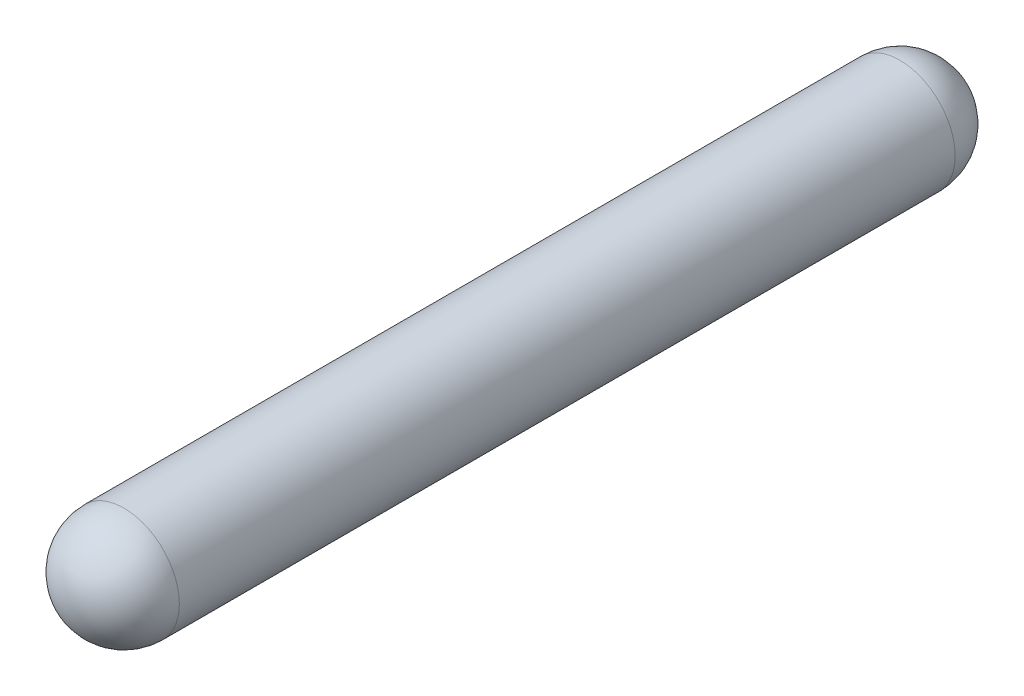
from build123d import *
from build123d.topology import SkipClean

# Parameters (mm, degrees)
SKETCH1_R           = 5
BOSS_EXTRUDE1_DEPTH = 70.18


with BuildPart() as part:
    # Sketch1 → Boss-Extrude1 (new body)
    with BuildSketch(Plane.XY):
        Circle(SKETCH1_R)
    extrude(amount=BOSS_EXTRUDE1_DEPTH)

    # Sketch2 → Revolve1 (revolve)
    with BuildSketch(Plane(origin=(0, 0, 0), x_dir=(0, 0, -1), z_dir=(1, 0, 0))):
        with BuildLine():
            Line((0, 5), (0, -5))
            ThreePointArc((0, -5), (5, 0), (0, 5))
        make_face()
    revolve(axis=Axis((0, 5, 0), (0, -1, 0)))

    # Sketch3 → Revolve2 (revolve)
    with SkipClean():  # the faces are left unmerged after this step: merging them gives an invalid solid
        with BuildSketch(Plane(origin=(0, 0, 0), x_dir=(0, 0, -1), z_dir=(1, 0, 0))):
            with BuildLine():
                Line((-70.18, 5), (-70.18, -5))
                ThreePointArc((-70.18, -5), (-75.18, 0), (-70.18, 5))
            make_face()
        revolve(axis=Axis((0, 5, 70.18), (0, -1, 0)))


solid = part.part
